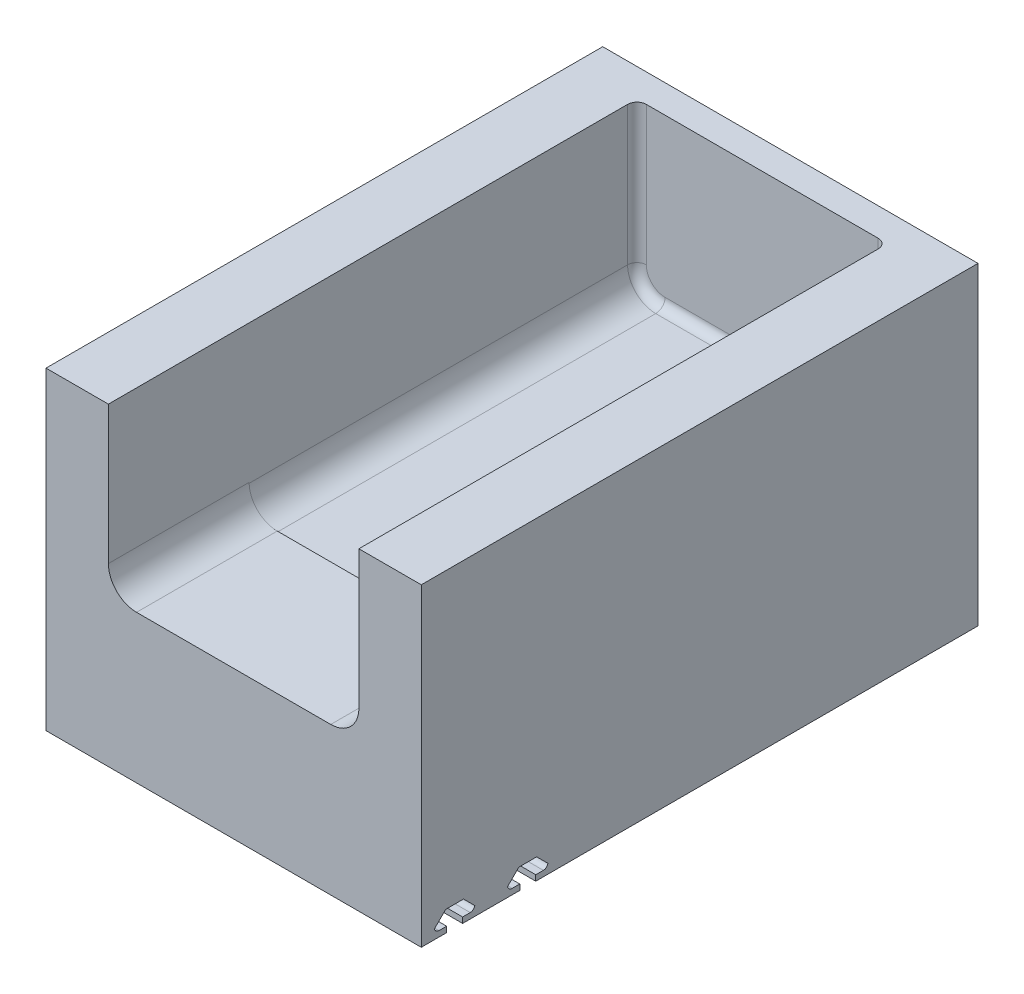
from build123d import *

# Parameters (mm, degrees)
SKETCH1_W               = 101.6
SKETCH1_H               = 38.1
BOSS_EXTRUDE1_DEPTH     = 40
SKETCH2_W               = 16.891
SKETCH2_H               = 38.1
BOSS_EXTRUDE2_DEPTH     = 45
FILLET1_R               = 7.62
CUT_EXTRUDE1_DEPTH      = 134.829976089
CUT_EXTRUDE1_DEPTH_BACK = 134.829976089
CUT_EXTRUDE2_DEPTH      = 134.829976089
CUT_EXTRUDE2_DEPTH_BACK = 134.829976089
FILLET2_R               = 1.27
BOSS_EXTRUDE3_DEPTH     = 105
FILLET3_R               = 7.62
SKETCH9_W               = 101.6
SKETCH9_H               = 85
BOSS_EXTRUDE4_DEPTH     = 7.62
FILLET4_R               = 2.54


with BuildPart() as part:
    # Sketch1 → Boss-Extrude1 (new body)
    with BuildSketch(Plane(origin=(0, 0, 0), x_dir=(1, 0, 0), z_dir=(0, 1, 0))):
        Rectangle(SKETCH1_W, SKETCH1_H)
    extrude(amount=BOSS_EXTRUDE1_DEPTH)

    # Sketch2 → Boss-Extrude2 (add)
    with BuildSketch(Plane(origin=(0, 40, 0), x_dir=(1, 0, 0), z_dir=(0, 1, 0))):
        with Locations((-42.3545, 0)):
            Rectangle(SKETCH2_W, SKETCH2_H)
        with Locations((42.3545, 0)):
            Rectangle(SKETCH2_W, SKETCH2_H)
    extrude(amount=BOSS_EXTRUDE2_DEPTH)

    # Fillet1
    fillet1_edges = [part.edges().sort_by_distance(p)[0] for p in [
        (-33.909, 40, 0),
        (33.909, 40, 0),
    ]]
    fillet(fillet1_edges, radius=FILLET1_R)

    # Sketch6 → Cut-Extrude1 (cut, two sides: drawn at the far end of the back side and taken through both)
    with BuildSketch(Plane.ZY.offset(50.8).offset(-CUT_EXTRUDE1_DEPTH_BACK)):
        Polygon((-11.938, 0), (-11.938, 1.524), (-15.24, 1.524), (-15.24, 2.54), (-12.186712919, 5.593287081), (-7.360712919, 5.593287081), (-4.307425838, 2.54), (-4.307425838, 1.524), (-7.609425838, 1.524), (-7.609425838, 0), align=None)
    extrude(amount=CUT_EXTRUDE1_DEPTH + CUT_EXTRUDE1_DEPTH_BACK, mode=Mode.SUBTRACT)

    # Sketch5 → Cut-Extrude2 (cut, two sides: drawn at the far end of the back side and taken through both)
    with BuildSketch(Plane.ZY.offset(50.8).offset(-CUT_EXTRUDE2_DEPTH_BACK)):
        Polygon((7.863425838, 0), (7.863425838, 1.524), (4.561425838, 1.524), (4.561425838, 2.54), (7.614712919, 5.593287081), (12.440712919, 5.593287081), (15.494, 2.54), (15.494, 1.524), (12.192, 1.524), (12.192, 0), align=None)
    extrude(amount=CUT_EXTRUDE2_DEPTH + CUT_EXTRUDE2_DEPTH_BACK, mode=Mode.SUBTRACT)

    # Fillet2
    # the kernel refuses this fillet: 1.27 mm, written as the material it adds along each edge
    with BuildSketch(Plane(origin=(-50.8, 1.524, -15.24), x_dir=(0, 0, 1), z_dir=(1, 0, 0)), Plane(origin=(-50.8, 1.524, 4.561425838), x_dir=(0, 0, 1), z_dir=(1, 0, 0))) as fillet2_piece_1:
        with BuildLine():
            CenterArc((1.244340789, -1.27), FILLET2_R, 90, 78.463040967)
            Line((0, -1.016), (-0.024886816, -1.01092))
            ThreePointArc((-0.024886816, -1.01092), (-0.0254, -0.508), (-0.0254, 0))
            Line((-0.0254, 0), (0, 0.0254))
            Line((0, 0.0254), (1.244340789, 0.0254))
            Line((1.244340789, 0.0254), (1.244340789, 0))
        make_face()
    extrude(amount=101.6)
    with BuildSketch(Plane(origin=(-50.8, 1.524, -4.307425838), x_dir=(0, 1.0, -1.5744186357080854e-12), z_dir=(1, 0, 0)), Plane(origin=(-50.8, 1.524, 15.494), x_dir=(0, 1.0, -1.561305765338501e-12), z_dir=(1, 0, 0))) as fillet2_piece_2:
        with BuildLine():
            CenterArc((1.27, -1.244340789), FILLET2_R, 101.536959033, 78.463040967)
            Line((0, -1.244340789), (-0.0254, -1.244340789))
            Line((-0.0254, -1.244340789), (-0.0254, 0))
            Line((-0.0254, 0), (0, 0.0254))
            ThreePointArc((0, 0.0254), (0.508, 0.0254), (1.01092, 0.024886816))
            Line((1.01092, 0.024886816), (1.016, 0))
        make_face()
    extrude(amount=101.6)

    # Sketch8 → Boss-Extrude3 (add)
    with BuildSketch(Plane(origin=(0, 0, -19.05), x_dir=(-1, 0, 0), z_dir=(0, 0, -1))):
        Polygon((-33.909, 39.760810351), (-50.8, 39.760810351), (-50.8, 0), (50.8, 0), (50.8, 39.760810351), (33.909, 39.760810351), align=None)
        Polygon((-50.8, 85), (-50.8, 39.760810351), (-33.909, 39.760810351), (-33.909, 47.62), (-33.909, 85), align=None)
        Polygon((33.909, 47.62), (33.909, 39.760810351), (50.8, 39.760810351), (50.8, 85), (33.909, 85), align=None)
    extrude(amount=BOSS_EXTRUDE3_DEPTH)

    # Fillet3
    fillet3_edges = [part.edges().sort_by_distance(p)[0] for p in [
        (-33.909, 39.760810351, -71.55),
        (33.909, 39.760810351, -71.55),
    ]]
    fillet(fillet3_edges, radius=FILLET3_R)

    # Sketch9 → Boss-Extrude4 (add)
    with BuildSketch(Plane(origin=(0, 0, -124.05), x_dir=(-1, 0, 0), z_dir=(0, 0, -1))):
        with Locations((0, 42.5)):
            Rectangle(SKETCH9_W, SKETCH9_H)
    extrude(amount=BOSS_EXTRUDE4_DEPTH)

    # Fillet4
    fillet4_edges = [part.edges().sort_by_distance(p)[0] for p in [
        (33.909, 66.190405175, -124.05),
        (-33.909, 66.190405175, -124.05),
        (0, 39.760810351, -124.05),
        (-31.677153673, 41.992656678, -124.05),
        (31.677153673, 41.992656678, -124.05),
    ]]
    fillet(fillet4_edges, radius=FILLET4_R)


solid = part.part
